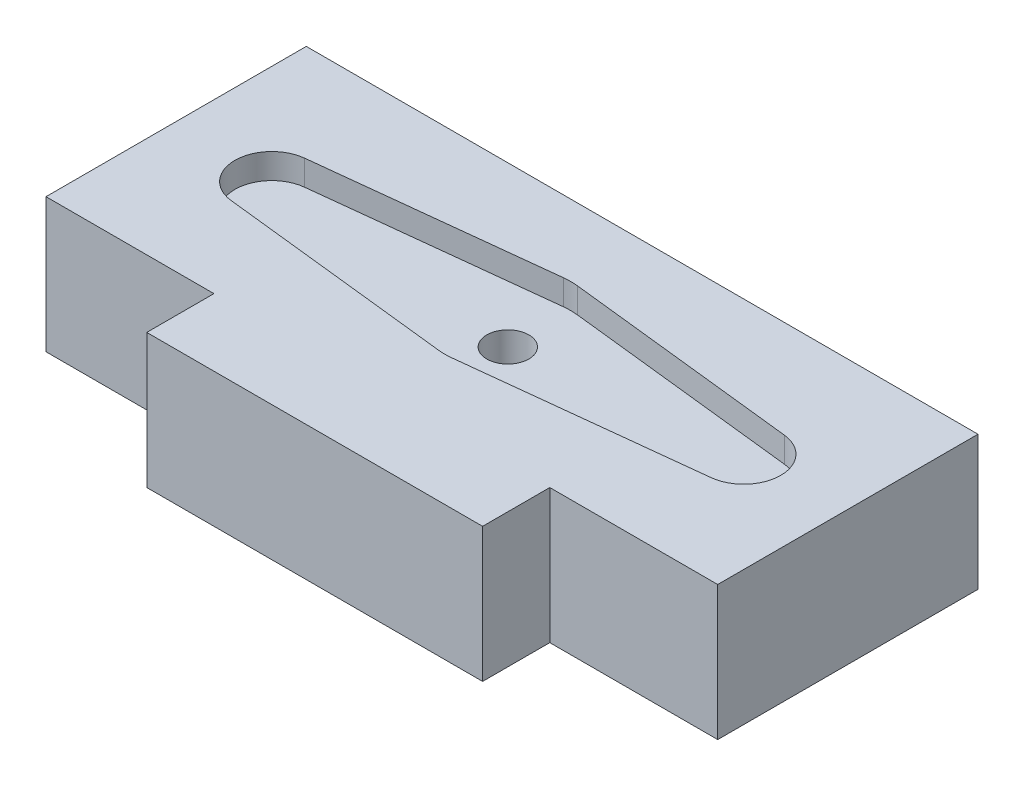
from build123d import *

# Parameters (mm, degrees)
SKETCH1_R                = 32.5
BOSS_EXTRUDE1_DEPTH      = 8
CUT_EXTRUDE1_DEPTH       = 1.5
CUT_EXTRUDE2_DEPTH       = 47.419284786
CUT_EXTRUDE2_DEPTH_BACK  = 47.419284786
SKETCH5_R                = 1.25
SKETCH6_R                = 3.5
CUT_EXTRUDE4_DEPTH       = 3.5
SKETCH7_W                = 123.867661852
SKETCH7_H                = 82.961065543
SKETCH7_W_2              = 43.388606137
SKETCH7_H_2              = 21.563495618
BOSS_EXTRUDE2_DEPTH      = 8
CUT_EXTRUDE8_DEPTH       = 80.219768621
CUT_EXTRUDE8_DEPTH_BACK  = 80.219768621
SKETCH9_W                = 154.66585695
SKETCH9_H                = 110.153188779
SKETCH9_W_2              = 40
SKETCH9_H_2              = 19.5
CUT_EXTRUDE10_DEPTH      = 25.418230894
CUT_EXTRUDE10_DEPTH_BACK = 25.418230894
SKETCH10_W               = 10
SKETCH10_H               = 4


with BuildPart() as part:
    # Sketch1 → Boss-Extrude1 (new body)
    with BuildSketch(Plane(origin=(0, 0, 0), x_dir=(1, 0, 0), z_dir=(0, 1, 0))):
        Circle(SKETCH1_R)
    extrude(amount=BOSS_EXTRUDE1_DEPTH)

    # Sketch4 → Cut-Extrude1 (cut)
    with BuildSketch(Plane(origin=(0, 8, 0), x_dir=(1, 0, 0), z_dir=(0, 1, 0))):
        with BuildLine():
            Line((-14.292704626, -2.186571395), (-0.413701068, -3.727110332))
            ThreePointArc((-0.413701068, -3.727110332), (0, -3.75), (0.413701068, -3.727110332))
            Line((0.413701068, -3.727110332), (14.292704626, -2.186571395))
            ThreePointArc((14.292704626, -2.186571395), (16.25, 0), (14.292704626, 2.186571395))
            Line((14.292704626, 2.186571395), (0.413701068, 3.727110332))
            ThreePointArc((0.413701068, 3.727110332), (0, 3.75), (-0.413701068, 3.727110332))
            Line((-0.413701068, 3.727110332), (-14.292704626, 2.186571395))
            ThreePointArc((-14.292704626, 2.186571395), (-16.25, 0), (-14.292704626, -2.186571395))
        make_face()
    extrude(amount=-CUT_EXTRUDE1_DEPTH, mode=Mode.SUBTRACT)

    # Sketch5 → Cut-Extrude2 (cut, two sides: drawn at the far end of the back side and taken through both)
    with BuildSketch(Plane(origin=(0, 6.5, 0), x_dir=(1, 0, 0), z_dir=(0, 1, 0)).offset(-CUT_EXTRUDE2_DEPTH_BACK)):
        Circle(SKETCH5_R)
    extrude(amount=CUT_EXTRUDE2_DEPTH + CUT_EXTRUDE2_DEPTH_BACK, mode=Mode.SUBTRACT)

    # Sketch6 → Cut-Extrude4 (cut)
    with BuildSketch(Plane.XZ):
        Circle(SKETCH6_R)
    extrude(amount=-CUT_EXTRUDE4_DEPTH, mode=Mode.SUBTRACT)

    # Sketch7 → Boss-Extrude2 (add)
    with BuildSketch(Plane(origin=(0, 8, 0), x_dir=(1, 0, 0), z_dir=(0, 1, 0))):
        with Locations((2.06954607, -4.512287032)):
            Rectangle(SKETCH7_W, SKETCH7_H)
        with Locations((-0.63198277, 1.081017378)):
            Rectangle(SKETCH7_W_2, SKETCH7_H_2, mode=Mode.SUBTRACT)
    extrude(amount=-BOSS_EXTRUDE2_DEPTH)

    # Sketch9 → Cut-Extrude8 (cut, two sides: drawn at the far end of the back side and taken through both)
    with BuildSketch(Plane(origin=(0, 0, 0), x_dir=(-1, 0, 0), z_dir=(0, -1, 0)).offset(-CUT_EXTRUDE8_DEPTH_BACK)):
        with Locations((-5.983948932, -5.764009698)):
            Rectangle(SKETCH9_W, SKETCH9_H)
        with Locations((0, -1.75)):
            Rectangle(SKETCH9_W_2, SKETCH9_H_2, mode=Mode.SUBTRACT)
    extrude(amount=CUT_EXTRUDE8_DEPTH + CUT_EXTRUDE8_DEPTH_BACK, mode=Mode.SUBTRACT)

    # Sketch10 → Cut-Extrude10 (cut, two sides: drawn at the far end of the back side and taken through both)
    with BuildSketch(Plane.XZ.offset(-CUT_EXTRUDE10_DEPTH_BACK)):
        with Locations((-15, 9.5)):
            Rectangle(SKETCH10_W, SKETCH10_H)
        with Locations((15, 9.5)):
            Rectangle(SKETCH10_W, SKETCH10_H)
    extrude(amount=CUT_EXTRUDE10_DEPTH + CUT_EXTRUDE10_DEPTH_BACK, mode=Mode.SUBTRACT)


solid = part.part
